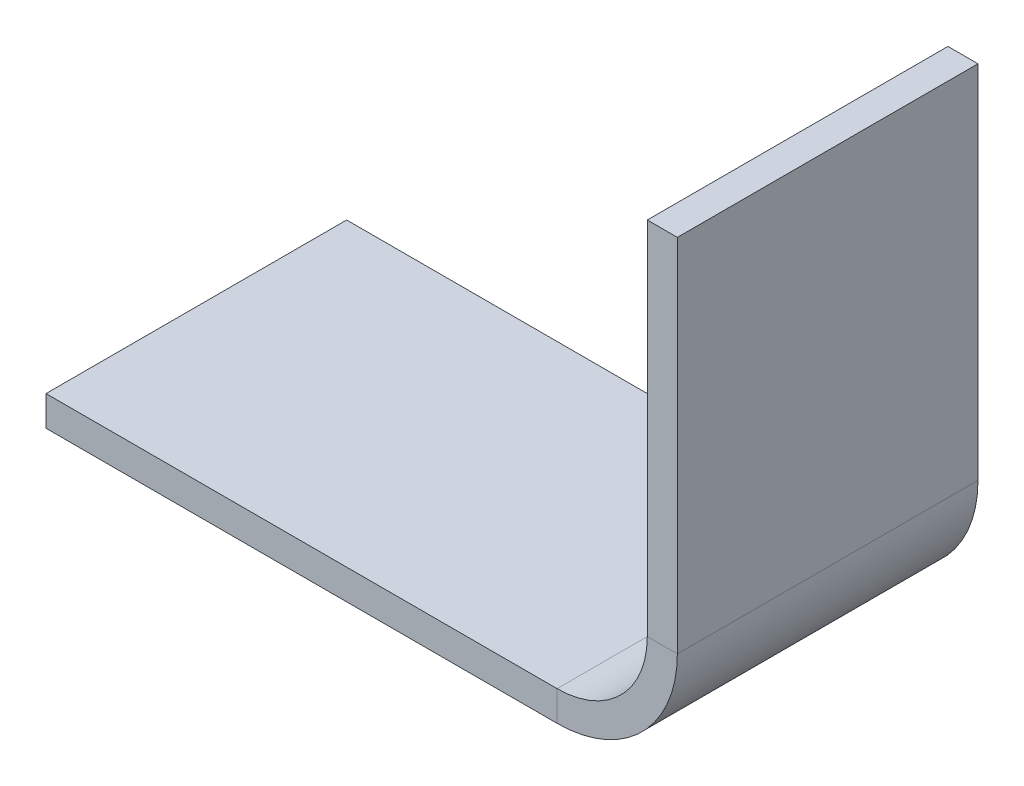
from build123d import *

# Parameters (mm, degrees)
SM_BASE_FLANGE_1_DEPTH = 10


# Sheet-metal steps are written as plain solids
with BuildPart() as part:
    # Sketch 1 → 基体-法兰1 (new body)
    with BuildSketch(Plane.XY):
        with BuildLine():
            Line((0, 0), (17, 0))
            ThreePointArc((17, 0), (19.121320344, 0.878679656), (20, 3))
            Line((20, 3), (20, 15))
            Line((20, 15), (21, 15))
            Line((21, 15), (21, 3))
            ThreePointArc((21, 3), (19.828427125, 0.171572875), (17, -1))
            Line((17, -1), (0, -1))
            Line((0, -1), (0, 0))
        make_face()
    extrude(amount=SM_BASE_FLANGE_1_DEPTH)


solid = part.part
